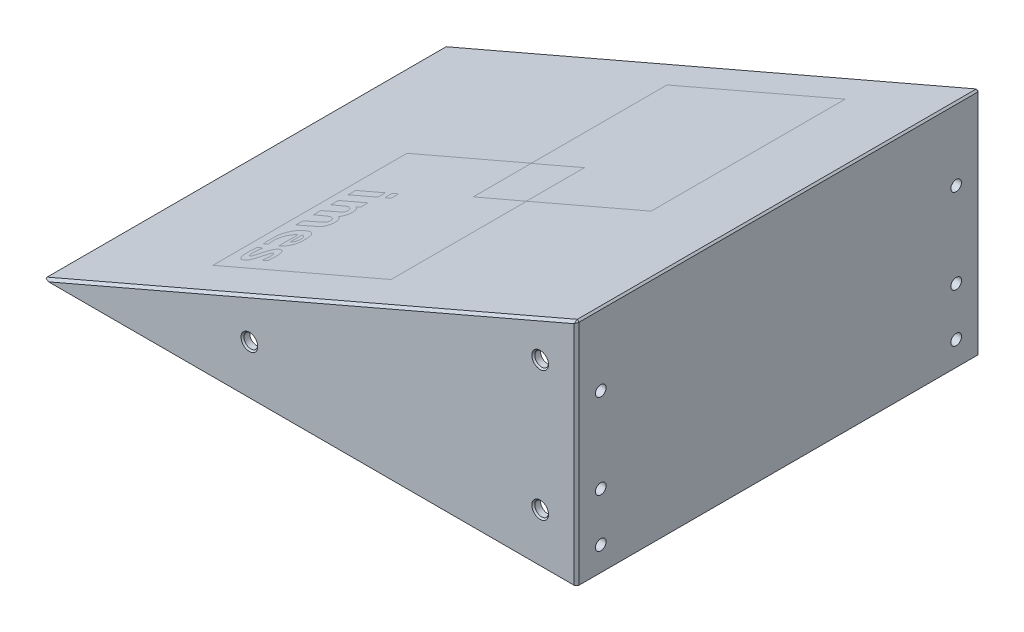
from build123d import *

# Parameters (mm, degrees)
BOSS_EXTRUDE1_DEPTH     = 166.666666667
CUT_EXTRUDE1_DEPTH      = 160.666666667
SKETCH3_R               = 2.2
CUT_EXTRUDE2_DEPTH      = 5
SKETCH4_R               = 2.2
CUT_EXTRUDE3_DEPTH      = 163.666666667
CUT_EXTRUDE7_DEPTH      = 1
BOSS_EXTRUDE5_DEPTH     = 1
BOSS_EXTRUDE5_2_DEPTH   = 1
BOSS_EXTRUDE6_DEPTH     = 1
SKETCH14_R              = 2.85
EINSCHMELZGEWINDE_DEPTH = 292.523236925
CHAMFER2_SIZE           = 0.6


with BuildPart() as part:
    # Sketch1 → Boss-Extrude1 (new body)
    with BuildSketch(Plane.XY):
        Polygon((0, 0), (-220.397368405, 0), (0, 95), align=None)
    extrude(amount=BOSS_EXTRUDE1_DEPTH)

    # Sketch2 → Cut-Extrude1 (cut)
    with BuildSketch(Plane.XY.offset(163.666666667)):
        Polygon((-5, 0), (-5, 87.400090745), (-178.22131418, 12.734839675), (-178.22131418, 0), align=None)
    extrude(amount=-CUT_EXTRUDE1_DEPTH, mode=Mode.SUBTRACT)

    # Sketch3 → Cut-Extrude2 (cut)
    with BuildSketch(Plane(origin=(0, 0, 0), x_dir=(0, 0, -1), z_dir=(1, 0, 0))):
        with Locations((-156.666666667, 10)):
            Circle(SKETCH3_R)
        with Locations((-156.666666667, 65)):
            Circle(SKETCH3_R)
        with Locations((-156.666666667, 30)):
            Circle(SKETCH3_R)
        with Locations((-10, 30)):
            Circle(SKETCH3_R)
        with Locations((-10, 65)):
            Circle(SKETCH3_R)
        with Locations((-10, 10)):
            Circle(SKETCH3_R)
    extrude(amount=-CUT_EXTRUDE2_DEPTH, mode=Mode.SUBTRACT)

    # Sketch4 → Cut-Extrude3 (cut)
    with BuildSketch(Plane(origin=(0, 0, 0), x_dir=(-1, 0, 0), z_dir=(0, 0, -1))):
        with Locations((15, 73.534405559)):
            Circle(SKETCH4_R)
        with Locations((15, 20)):
            Circle(SKETCH4_R)
        with Locations((135, 20)):
            Circle(SKETCH4_R)
    cut_extrude3 = extrude(amount=-CUT_EXTRUDE3_DEPTH, mode=Mode.SUBTRACT)

    # Mirror1: Cut-Extrude3 across plane
    add(cut_extrude3.mirror(Plane(origin=(0, 0, 83.333333333), x_dir=(1, 0, 0), z_dir=(0, 0, -1))), mode=Mode.SUBTRACT)

    # Chamfer1
    # the kernel refuses this chamfer: 1, 0.76094484 mm, written as the material it takes off along each edge
    with BuildSketch(Plane(origin=(-0.566264223, 94.059603605, 0.666666667), x_dir=(-0.6636676001479009, -0.3450951072209674, -0.6636676001479013), z_dir=(0.48166378315170105, 0.48166378315167974, -0.7321202087089269))) as chamfer1_piece_1:
        Polygon((-0.576464838, -0.320947287), (0.930313555, -0.320947287), (-0.353848716, 0.641894573), align=None)
    extrude(amount=1.335162391, mode=Mode.SUBTRACT)
    with BuildSketch(Plane(origin=(-0.566264223, 94.059603605, 166), x_dir=(-0.663667600147901, -0.3450951072209673, 0.6636676001479013), z_dir=(0.4816637831517013, 0.4816637831516795, 0.732120208708927))) as chamfer1_piece_2:
        Polygon((-0.576464838, 0.320947287), (0.930313555, 0.320947287), (-0.353848716, -0.641894573), align=None)
    extrude(amount=1.335162391, mode=Mode.SUBTRACT)
    with BuildSketch(Plane(origin=(-222.759002418, -1.017957849, 0), x_dir=(0.39568367544405514, -0.9179751661981379, -0.027495876610586115), z_dir=(0.9183223683555912, 0.39583333333333354, 0))) as chamfer1_piece_3:
        with BuildLine():
            Line((1.028673195, 0), (-0.056547155, -1.027117794))
            Line((-0.056547155, -1.027117794), (-0.076539593, -1.026567876))
            ThreePointArc((-0.076539593, -1.026567876), (-0.034129227, -0.51339783), (-0.019992438, 0.000549918))
            Line((-0.019992438, 0.000549918), (0.000549918, 0.019992438))
            ThreePointArc((0.000549918, 0.019992438), (0.514497665, 0.00585565), (1.029223113, 0.019992438))
            Line((1.029223113, 0.019992438), (1.028673195, 0))
        make_face()
    extrude(amount=245.143365976, mode=Mode.SUBTRACT)
    with BuildSketch(Plane(origin=(0, 97.571682988, 0), x_dir=(0.027495876610586372, 0, 0.9996219169112968), z_dir=(0, -1, 0))) as chamfer1_piece_4:
        with BuildLine():
            Line((1.028673195, 0), (-0.056547155, 1.027117794))
            Line((-0.056547155, 1.027117794), (-0.076539593, 1.026567876))
            ThreePointArc((-0.076539593, 1.026567876), (-0.034129227, 0.51339783), (-0.019992438, -0.000549918))
            Line((-0.019992438, -0.000549918), (0.000549918, -0.019992438))
            ThreePointArc((0.000549918, -0.019992438), (0.514497665, -0.00585565), (1.029223113, -0.019992438))
            Line((1.029223113, -0.019992438), (1.028673195, 0))
        make_face()
    extrude(amount=100.143365976, mode=Mode.SUBTRACT)
    with BuildSketch(Plane(origin=(0, 97.571682988, 166.666666667), x_dir=(0.027495876610586483, 0, -0.9996219169112968), z_dir=(0, -1, 0))) as chamfer1_piece_5:
        with BuildLine():
            Line((1.028673195, 0), (-0.056547155, -1.027117794))
            Line((-0.056547155, -1.027117794), (-0.076539593, -1.026567876))
            ThreePointArc((-0.076539593, -1.026567876), (-0.034129227, -0.51339783), (-0.019992438, 0.000549918))
            Line((-0.019992438, 0.000549918), (0.000549918, 0.019992438))
            ThreePointArc((0.000549918, 0.019992438), (0.514497665, 0.00585565), (1.029223113, 0.019992438))
            Line((1.029223113, 0.019992438), (1.028673195, 0))
        make_face()
    extrude(amount=100.143365976, mode=Mode.SUBTRACT)
    with BuildSketch(Plane(origin=(-222.759002418, -1.017957849, 166.666666667), x_dir=(0.3956836754440552, -0.9179751661981382, 0.027495876610582105), z_dir=(0.9183223683555912, 0.39583333333333354, 0))) as chamfer1_piece_6:
        with BuildLine():
            Line((1.028673195, 0), (-0.056547155, 1.027117794))
            Line((-0.056547155, 1.027117794), (-0.076539593, 1.026567876))
            ThreePointArc((-0.076539593, 1.026567876), (-0.034129227, 0.51339783), (-0.019992438, -0.000549918))
            Line((-0.019992438, -0.000549918), (0.000549918, -0.019992438))
            ThreePointArc((0.000549918, -0.019992438), (0.514497665, -0.00585565), (1.029223113, -0.019992438))
            Line((1.029223113, -0.019992438), (1.028673195, 0))
        make_face()
    extrude(amount=245.143365976, mode=Mode.SUBTRACT)
    with BuildSketch(Plane(origin=(-220.397368405, 0, -2.571682988), x_dir=(0.9987615609068209, -0.04975283363759973, 0), z_dir=(0, 0, 1))) as chamfer1_piece_7:
        with BuildLine():
            Line((0.747091846, 0), (0.910401862, 0.47889142))
            Line((0.910401862, 0.47889142), (0.901581217, 0.496841245))
            ThreePointArc((0.901581217, 0.496841245), (0.452617424, 0.244703092), (-0.008820645, 0.017949825))
            Line((-0.008820645, 0.017949825), (0.000995057, -0.019975231))
            ThreePointArc((0.000995057, -0.019975231), (0.373616325, -0.001413279), (0.748086903, -0.019975231))
            Line((0.748086903, -0.019975231), (0.747091846, 0))
        make_face()
    extrude(amount=171.810032643, mode=Mode.SUBTRACT)
    with BuildSketch(Plane(origin=(0, 95, -2.571682988), x_dir=(0.027495876610585647, -0.9996219169112968, 0), z_dir=(0, 0, 1))) as chamfer1_piece_8:
        with BuildLine():
            Line((1.028673195, 0), (0.252828256, -0.734306302))
            Line((0.252828256, -0.734306302), (0.234251077, -0.741714974))
            ThreePointArc((0.234251077, -0.741714974), (0.125099763, -0.367677326), (-0.018577179, -0.007408672))
            Line((-0.018577179, -0.007408672), (0.000549918, 0.019992438))
            ThreePointArc((0.000549918, 0.019992438), (0.514497665, 0.00585565), (1.029223113, 0.019992438))
            Line((1.029223113, 0.019992438), (1.028673195, 0))
        make_face()
    extrude(amount=171.810032643, mode=Mode.SUBTRACT)

    # Sketch13 → Cut-Extrude7 (cut)
    # profile 1 of 3: a face of its own
    with BuildSketch(Plane(origin=(-166.880136488, 23.068047813, 13.963503361), x_dir=(0, 0, 1), z_dir=(-0.3958333333333336, 0.9183223683555912, 0))):
        Polygon((55.9477248, 56.0831744), (55.9477248, 28.10930688), (55.9477248, 0.13544448), (95.97812736, 0.13544448), (136.0085248, 0.13544448), (136.0085248, 40.16584192), (136.0085248, 80.19624448), (108.03465728, 80.19624448), (80.061216138, 80.19624448), (80.06227456, 80.0607744), (80.02766336, 68.10584064), (79.99305728, 56.15092736), (68.03812352, 56.11631616), (56.083191808, 56.08170496), align=None)
        Polygon((84.93758976, 18.6943744), (84.93758976, 11.98877696), (84.93758976, 5.2831744), (83.37972736, 5.2831744), (81.82185984, 5.2831744), (81.82185984, 11.98877696), (81.82185984, 18.6943744), (83.37972736, 18.6943744), align=None, mode=Mode.SUBTRACT)
        with BuildLine():
            Line((96.11359232, 15.28617984), (95.79177984, 15.62858496))
            add(Edge.make_bspline(
                [(94.16347648, 15.90716416), (94.84733952, 16.18079232), (95.35429632, 16.09405952), (95.79177984, 15.62858496)],
                knots=[0, 0, 0, 0, 1, 1, 1, 1], degree=3))
            add(Edge.make_bspline(
                [(92.5133312, 13.74984192), (92.99899392, 14.9786624), (93.50885888, 15.64524032), (94.16347648, 15.90716416)],
                knots=[0, 0, 0, 0, 1, 1, 1, 1], degree=3))
            add(Edge.make_bspline(
                [(92.14528, 9.11010816), (92.1899264, 12.7598592), (92.20696576, 12.97467392), (92.5133312, 13.74984192)],
                knots=[0, 0, 0, 0, 1, 1, 1, 1], degree=3))
            Line((92.14528, 9.11010816), (92.098688, 5.2831744))
            Line((92.098688, 5.2831744), (90.55025152, 5.2831744))
            Line((90.55025152, 5.2831744), (89.00180992, 5.2831744))
            Line((89.00180992, 5.2831744), (89.00180992, 11.98877696))
            Line((89.00180992, 11.98877696), (89.00180992, 18.6943744))
            Line((89.00180992, 18.6943744), (90.55967744, 18.6943744))
            Line((90.55967744, 18.6943744), (92.11754496, 18.6943744))
            Line((92.11754496, 18.6943744), (92.11754496, 17.65185536))
            Line((92.11754496, 17.65185536), (92.11754496, 16.6093312))
            Line((92.11754496, 16.6093312), (92.509696, 17.22769408))
            add(Edge.make_bspline(
                [(96.97079808, 18.75655168), (95.15689472, 19.29522176), (93.44988672, 18.71021568), (92.509696, 17.22769408)],
                knots=[0, 0, 0, 0, 1, 1, 1, 1], degree=3))
            add(Edge.make_bspline(
                [(98.84232704, 16.9531392), (98.5273344, 17.84002048), (97.84586752, 18.49668608), (96.97079808, 18.75655168)],
                knots=[0, 0, 0, 0, 1, 1, 1, 1], degree=3))
            Line((98.84232704, 16.9531392), (99.07701248, 16.29236736))
            Line((99.07701248, 16.29236736), (99.57395456, 17.06122752))
            add(Edge.make_bspline(
                [(103.3669632, 18.92215296), (101.906048, 19.09517824), (100.41608704, 18.36417536), (99.57395456, 17.06122752)],
                knots=[0, 0, 0, 0, 1, 1, 1, 1], degree=3))
            add(Edge.make_bspline(
                [(106.09721344, 16.86557696), (105.53609728, 18.08348672), (104.61966848, 18.77379072), (103.3669632, 18.92215296)],
                knots=[0, 0, 0, 0, 1, 1, 1, 1], degree=3))
            add(Edge.make_bspline(
                [(106.44891648, 10.73570816), (106.40990208, 16.09991168), (106.40421888, 16.19921408), (106.09721344, 16.86557696)],
                knots=[0, 0, 0, 0, 1, 1, 1, 1], degree=3))
            Line((106.44891648, 10.73570816), (106.48854528, 5.2831744))
            Line((106.48854528, 5.2831744), (105.0018304, 5.2831744))
            Line((105.0018304, 5.2831744), (103.5151104, 5.2831744))
            Line((103.5151104, 5.2831744), (103.4720512, 10.12611072))
            add(Edge.make_bspline(
                [(102.56379904, 15.97869056), (103.39983872, 15.63238912), (103.424512, 15.47338752), (103.4720512, 10.12611072)],
                knots=[0, 0, 0, 0, 1, 1, 1, 1], degree=3))
            add(Edge.make_bspline(
                [(99.98057984, 14.34333184), (100.52537856, 15.60974336), (101.68388608, 16.34316288), (102.56379904, 15.97869056)],
                knots=[0, 0, 0, 0, 1, 1, 1, 1], degree=3))
            add(Edge.make_bspline(
                [(99.29961472, 8.5682432), (99.30217472, 12.05631488), (99.41742592, 13.03423488), (99.98057984, 14.34333184)],
                knots=[0, 0, 0, 0, 1, 1, 1, 1], degree=3))
            Line((99.29961472, 8.5682432), (99.29705472, 5.2831744))
            Line((99.29705472, 5.2831744), (97.74395392, 5.2831744))
            Line((97.74395392, 5.2831744), (96.19085312, 5.2831744))
            Line((96.19085312, 5.2831744), (96.15224832, 10.28467712))
            Line((96.15224832, 10.28467712), (96.11359232, 15.28617984))
        make_face(mode=Mode.SUBTRACT)
        Polygon((84.93758976, 24.65490944), (84.93758976, 23.1647744), (84.93758976, 21.67464448), (83.37972736, 21.67464448), (81.82185984, 21.67464448), (81.82185984, 23.1647744), (81.82185984, 24.65490944), (83.37972736, 24.65490944), align=None, mode=Mode.SUBTRACT)
        with BuildLine():
            Line((120.02345984, 5.44058368), (119.3799936, 5.28499712))
            Line((119.3799936, 5.28499712), (119.37975808, 5.28499712))
            add(Edge.make_bspline(
                [(114.21233152, 5.2183552), (115.05984, 4.98085888), (118.29446144, 5.02257152), (119.37975808, 5.28499712)],
                knots=[0, 0, 0, 0, 1, 1, 1, 1], degree=3))
            add(Edge.make_bspline(
                [(109.9058944, 9.88904448), (110.56429056, 7.42414336), (112.03566592, 5.82831616), (114.21233152, 5.2183552)],
                knots=[0, 0, 0, 0, 1, 1, 1, 1], degree=3))
            add(Edge.make_bspline(
                [(109.96598784, 15.40030464), (109.56829184, 14.13541376), (109.53704448, 11.26994432), (109.9058944, 9.88904448)],
                knots=[0, 0, 0, 0, 1, 1, 1, 1], degree=3))
            add(Edge.make_bspline(
                [(111.73879808, 17.97809664), (110.880128, 17.32316672), (110.30983168, 16.49392128), (109.96598784, 15.40030464)],
                knots=[0, 0, 0, 0, 1, 1, 1, 1], degree=3))
            add(Edge.make_bspline(
                [(115.34962176, 18.89321984), (113.6010496, 18.89833984), (112.61898752, 18.64944128), (111.73879808, 17.97809664)],
                knots=[0, 0, 0, 0, 1, 1, 1, 1], degree=3))
            add(Edge.make_bspline(
                [(117.6525568, 18.51360256), (116.9232128, 18.8503296), (116.68675584, 18.88930816), (115.34962176, 18.89321984)],
                knots=[0, 0, 0, 0, 1, 1, 1, 1], degree=3))
            add(Edge.make_bspline(
                [(118.96238592, 17.65451264), (118.68901888, 17.92062464), (118.09959424, 18.30721536), (117.6525568, 18.51360256)],
                knots=[0, 0, 0, 0, 1, 1, 1, 1], degree=3))
            add(Edge.make_bspline(
                [(120.42883584, 13.4450432), (120.42678784, 15.07685376), (119.81919744, 16.82044928), (118.96238592, 17.65451264)],
                knots=[0, 0, 0, 0, 1, 1, 1, 1], degree=3))
            Line((120.42883584, 13.4450432), (120.42985984, 12.86930944))
            Line((120.42985984, 12.86930944), (116.4970752, 12.86930944))
            add(Edge.make_bspline(
                [(112.55718912, 11.67983104), (112.30148096, 12.95308288), (112.02400768, 12.86930944), (116.4970752, 12.86930944)],
                knots=[0, 0, 0, 0, 1, 1, 1, 1], degree=3))
            add(Edge.make_bspline(
                [(115.30171392, 7.65583872), (113.98072832, 8.37557248), (112.90361856, 9.954816), (112.55718912, 11.67983104)],
                knots=[0, 0, 0, 0, 1, 1, 1, 1], degree=3))
            add(Edge.make_bspline(
                [(117.21089536, 7.20364544), (116.22436864, 7.25110784), (115.90634496, 7.32640256), (115.30171392, 7.65583872)],
                knots=[0, 0, 0, 0, 1, 1, 1, 1], degree=3))
            add(Edge.make_bspline(
                [(119.80281856, 7.53042944), (119.09603328, 7.25920768), (118.25651712, 7.15336192), (117.21089536, 7.20364544)],
                knots=[0, 0, 0, 0, 1, 1, 1, 1], degree=3))
            add(Edge.make_bspline(
                [(120.02345984, 6.52784128), (120.02345984, 7.47683328), (119.99540224, 7.60433152), (119.80281856, 7.53042944)],
                knots=[0, 0, 0, 0, 1, 1, 1, 1], degree=3))
            Line((120.02345984, 6.52784128), (120.02345984, 5.44058368))
        make_face(mode=Mode.SUBTRACT)
        with BuildLine():
            Line((130.3189248, 18.53386752), (130.3189248, 17.25945344))
            add(Edge.make_bspline(
                [(130.26732032, 15.98504448), (130.29568512, 15.98504448), (130.3189248, 16.55852544), (130.3189248, 17.25945344)],
                knots=[0, 0, 0, 0, 1, 1, 1, 1], degree=3))
            add(Edge.make_bspline(
                [(129.35291904, 16.30784), (129.827456, 16.130304), (130.23893504, 15.98504448), (130.26732032, 15.98504448)],
                knots=[0, 0, 0, 0, 1, 1, 1, 1], degree=3))
            add(Edge.make_bspline(
                [(127.91046656, 16.72681472), (128.22927872, 16.67392), (128.87838208, 16.48538112), (129.35291904, 16.30784)],
                knots=[0, 0, 0, 0, 1, 1, 1, 1], degree=3))
            add(Edge.make_bspline(
                [(125.30665984, 15.53564672), (125.30665984, 16.27826176), (126.71919616, 16.92445696), (127.91046656, 16.72681472)],
                knots=[0, 0, 0, 0, 1, 1, 1, 1], degree=3))
            add(Edge.make_bspline(
                [(127.80204032, 13.2158976), (125.81556736, 14.51283968), (125.30665984, 14.98592768), (125.30665984, 15.53564672)],
                knots=[0, 0, 0, 0, 1, 1, 1, 1], degree=3))
            add(Edge.make_bspline(
                [(131.127424, 8.87304192), (131.124352, 10.65903104), (130.53051904, 11.43450624), (127.80204032, 13.2158976)],
                knots=[0, 0, 0, 0, 1, 1, 1, 1], degree=3))
            add(Edge.make_bspline(
                [(128.08372736, 5.1959296), (130.11843072, 5.7381376), (131.13075712, 6.96113152), (131.127424, 8.87304192)],
                knots=[0, 0, 0, 0, 1, 1, 1, 1], degree=3))
            add(Edge.make_bspline(
                [(123.74879232, 5.2180992), (124.8105216, 4.97885696), (127.22277888, 4.96653312), (128.08372736, 5.1959296)],
                knots=[0, 0, 0, 0, 1, 1, 1, 1], degree=3))
            add(Edge.make_bspline(
                [(122.76665856, 5.4099456), (122.85979136, 5.4053376), (123.30174976, 5.31883008), (123.74879232, 5.2180992)],
                knots=[0, 0, 0, 0, 1, 1, 1, 1], degree=3))
            add(Edge.make_bspline(
                [(122.5973248, 6.78780416), (122.5973248, 5.78742272), (122.642944, 5.41629952), (122.76665856, 5.4099456)],
                knots=[0, 0, 0, 0, 1, 1, 1, 1], degree=3))
            add(Edge.make_bspline(
                [(122.83439104, 8.05780992), (122.61771264, 8.14843392), (122.5973248, 8.03922432), (122.5973248, 6.78780416)],
                knots=[0, 0, 0, 0, 1, 1, 1, 1], degree=3))
            add(Edge.make_bspline(
                [(128.2869248, 8.54756864), (128.2869248, 7.20859136), (125.46983936, 6.95555584), (122.83439104, 8.05780992)],
                knots=[0, 0, 0, 0, 1, 1, 1, 1], degree=3))
            add(Edge.make_bspline(
                [(125.85259008, 10.84009472), (127.7722624, 9.53900544), (128.2869248, 9.05432576), (128.2869248, 8.54756864)],
                knots=[0, 0, 0, 0, 1, 1, 1, 1], degree=3))
            add(Edge.make_bspline(
                [(122.6016256, 15.17224448), (122.6046976, 13.51450112), (123.32726272, 12.55168512), (125.85259008, 10.84009472)],
                knots=[0, 0, 0, 0, 1, 1, 1, 1], degree=3))
            add(Edge.make_bspline(
                [(129.01808128, 18.76808704), (125.2164864, 19.45257984), (122.59634688, 17.9842304), (122.6016256, 15.17224448)],
                knots=[0, 0, 0, 0, 1, 1, 1, 1], degree=3))
            Line((129.01808128, 18.76808704), (130.3189248, 18.53386752))
        make_face(mode=Mode.SUBTRACT)
    # profile 2 of 3: a face of its own
    with BuildSketch(Plane(origin=(-166.880136488, 23.068047813, 13.963503361), x_dir=(0, 0, 1), z_dir=(-0.3958333333333336, 0.9183223683555912, 0))):
        Polygon((27.973858304, 56.0831744), (55.9477248, 56.0831744), (56.083191808, 56.08170496), (56.083191808, 68.07123968), (56.083191808, 80.0607744), (68.0727296, 80.0607744), (80.06227456, 80.0607744), (80.061216138, 80.19624448), (80.06078976, 80.19624448), (80.06078976, 80.250817587), (80.06078976, 108.170108928), (80.06078976, 136.143975936), (40.030391808, 136.143975936), (-8.192e-06, 136.143975936), (-8.192e-06, 96.113575936), (-8.192e-06, 56.0831744), align=None)
    # profile 3 of 3: a face of its own
    with BuildSketch(Plane(origin=(-166.880136488, 23.068047813, 13.963503361), x_dir=(0, 0, 1), z_dir=(-0.3958333333333336, 0.9183223683555912, 0))):
        with BuildLine():
            Line((117.48526592, 14.6303744), (117.41343744, 15.1659008))
            add(Edge.make_bspline(
                [(113.43136768, 16.35399168), (114.89675776, 17.64062208), (117.1725824, 16.96160256), (117.41343744, 15.1659008)],
                knots=[0, 0, 0, 0, 1, 1, 1, 1], degree=3))
            add(Edge.make_bspline(
                [(112.57278976, 14.83792896), (112.57278976, 15.26205952), (112.95362048, 15.93452544), (113.43136768, 16.35399168)],
                knots=[0, 0, 0, 0, 1, 1, 1, 1], degree=3))
            add(Edge.make_bspline(
                [(115.02902784, 14.6303744), (112.91313152, 14.6303744), (112.57278976, 14.6591488), (112.57278976, 14.83792896)],
                knots=[0, 0, 0, 0, 1, 1, 1, 1], degree=3))
            Line((115.02902784, 14.6303744), (117.48526592, 14.6303744))
        make_face()
    extrude(amount=-CUT_EXTRUDE7_DEPTH, mode=Mode.SUBTRACT)

    # Sketch14 → Einschmelzgewinde (cut, through all)
    with BuildSketch(Plane.XY.offset(166.666666667)):
        with Locations((-135, 20)):
            Circle(SKETCH14_R)
        with Locations((-15, 20)):
            Circle(SKETCH14_R)
        with Locations((-15, 73.534405559)):
            Circle(SKETCH14_R)
    extrude(amount=-EINSCHMELZGEWINDE_DEPTH, mode=Mode.SUBTRACT)

    # Chamfer2
    chamfer2_edges = [part.edges().sort_by_distance(p)[0] for p in [
        (-137.85, 20, 0),
        (-137.85, 20, 166.666666667),
        (-17.85, 20, 0),
        (-17.85, 20, 166.666666667),
        (-17.85, 73.534405559, 0),
        (-17.85, 73.534405559, 166.666666667),
    ]]
    chamfer(chamfer2_edges, length=CHAMFER2_SIZE)


with BuildPart() as body_2:
    # Sketch13<3> → Boss-Extrude5 (new body)
    with BuildSketch(Plane(origin=(-166.880136488, 23.068047813, 13.963503361), x_dir=(0, 0, 1), z_dir=(-0.3958333333333336, 0.9183223683555912, 0))):
        Polygon((55.9477248, 56.0831744), (55.9477248, 28.10930688), (55.9477248, 0.13544448), (95.97812736, 0.13544448), (136.0085248, 0.13544448), (136.0085248, 40.16584192), (136.0085248, 80.19624448), (108.03465728, 80.19624448), (80.061216138, 80.19624448), (80.06227456, 80.0607744), (80.02766336, 68.10584064), (79.99305728, 56.15092736), (68.03812352, 56.11631616), (56.083191808, 56.08170496), align=None)
        Polygon((84.93758976, 18.6943744), (84.93758976, 11.98877696), (84.93758976, 5.2831744), (83.37972736, 5.2831744), (81.82185984, 5.2831744), (81.82185984, 11.98877696), (81.82185984, 18.6943744), (83.37972736, 18.6943744), align=None, mode=Mode.SUBTRACT)
        with BuildLine():
            Line((96.11359232, 15.28617984), (95.79177984, 15.62858496))
            add(Edge.make_bspline(
                [(94.16347648, 15.90716416), (94.84733952, 16.18079232), (95.35429632, 16.09405952), (95.79177984, 15.62858496)],
                knots=[0, 0, 0, 0, 1, 1, 1, 1], degree=3))
            add(Edge.make_bspline(
                [(92.5133312, 13.74984192), (92.99899392, 14.9786624), (93.50885888, 15.64524032), (94.16347648, 15.90716416)],
                knots=[0, 0, 0, 0, 1, 1, 1, 1], degree=3))
            add(Edge.make_bspline(
                [(92.14528, 9.11010816), (92.1899264, 12.7598592), (92.20696576, 12.97467392), (92.5133312, 13.74984192)],
                knots=[0, 0, 0, 0, 1, 1, 1, 1], degree=3))
            Line((92.14528, 9.11010816), (92.098688, 5.2831744))
            Line((92.098688, 5.2831744), (90.55025152, 5.2831744))
            Line((90.55025152, 5.2831744), (89.00180992, 5.2831744))
            Line((89.00180992, 5.2831744), (89.00180992, 11.98877696))
            Line((89.00180992, 11.98877696), (89.00180992, 18.6943744))
            Line((89.00180992, 18.6943744), (90.55967744, 18.6943744))
            Line((90.55967744, 18.6943744), (92.11754496, 18.6943744))
            Line((92.11754496, 18.6943744), (92.11754496, 17.65185536))
            Line((92.11754496, 17.65185536), (92.11754496, 16.6093312))
            Line((92.11754496, 16.6093312), (92.509696, 17.22769408))
            add(Edge.make_bspline(
                [(96.97079808, 18.75655168), (95.15689472, 19.29522176), (93.44988672, 18.71021568), (92.509696, 17.22769408)],
                knots=[0, 0, 0, 0, 1, 1, 1, 1], degree=3))
            add(Edge.make_bspline(
                [(98.84232704, 16.9531392), (98.5273344, 17.84002048), (97.84586752, 18.49668608), (96.97079808, 18.75655168)],
                knots=[0, 0, 0, 0, 1, 1, 1, 1], degree=3))
            Line((98.84232704, 16.9531392), (99.07701248, 16.29236736))
            Line((99.07701248, 16.29236736), (99.57395456, 17.06122752))
            add(Edge.make_bspline(
                [(103.3669632, 18.92215296), (101.906048, 19.09517824), (100.41608704, 18.36417536), (99.57395456, 17.06122752)],
                knots=[0, 0, 0, 0, 1, 1, 1, 1], degree=3))
            add(Edge.make_bspline(
                [(106.09721344, 16.86557696), (105.53609728, 18.08348672), (104.61966848, 18.77379072), (103.3669632, 18.92215296)],
                knots=[0, 0, 0, 0, 1, 1, 1, 1], degree=3))
            add(Edge.make_bspline(
                [(106.44891648, 10.73570816), (106.40990208, 16.09991168), (106.40421888, 16.19921408), (106.09721344, 16.86557696)],
                knots=[0, 0, 0, 0, 1, 1, 1, 1], degree=3))
            Line((106.44891648, 10.73570816), (106.48854528, 5.2831744))
            Line((106.48854528, 5.2831744), (105.0018304, 5.2831744))
            Line((105.0018304, 5.2831744), (103.5151104, 5.2831744))
            Line((103.5151104, 5.2831744), (103.4720512, 10.12611072))
            add(Edge.make_bspline(
                [(102.56379904, 15.97869056), (103.39983872, 15.63238912), (103.424512, 15.47338752), (103.4720512, 10.12611072)],
                knots=[0, 0, 0, 0, 1, 1, 1, 1], degree=3))
            add(Edge.make_bspline(
                [(99.98057984, 14.34333184), (100.52537856, 15.60974336), (101.68388608, 16.34316288), (102.56379904, 15.97869056)],
                knots=[0, 0, 0, 0, 1, 1, 1, 1], degree=3))
            add(Edge.make_bspline(
                [(99.29961472, 8.5682432), (99.30217472, 12.05631488), (99.41742592, 13.03423488), (99.98057984, 14.34333184)],
                knots=[0, 0, 0, 0, 1, 1, 1, 1], degree=3))
            Line((99.29961472, 8.5682432), (99.29705472, 5.2831744))
            Line((99.29705472, 5.2831744), (97.74395392, 5.2831744))
            Line((97.74395392, 5.2831744), (96.19085312, 5.2831744))
            Line((96.19085312, 5.2831744), (96.15224832, 10.28467712))
            Line((96.15224832, 10.28467712), (96.11359232, 15.28617984))
        make_face(mode=Mode.SUBTRACT)
        Polygon((84.93758976, 24.65490944), (84.93758976, 23.1647744), (84.93758976, 21.67464448), (83.37972736, 21.67464448), (81.82185984, 21.67464448), (81.82185984, 23.1647744), (81.82185984, 24.65490944), (83.37972736, 24.65490944), align=None, mode=Mode.SUBTRACT)
        with BuildLine():
            Line((120.02345984, 5.44058368), (119.3799936, 5.28499712))
            Line((119.3799936, 5.28499712), (119.37975808, 5.28499712))
            add(Edge.make_bspline(
                [(114.21233152, 5.2183552), (115.05984, 4.98085888), (118.29446144, 5.02257152), (119.37975808, 5.28499712)],
                knots=[0, 0, 0, 0, 1, 1, 1, 1], degree=3))
            add(Edge.make_bspline(
                [(109.9058944, 9.88904448), (110.56429056, 7.42414336), (112.03566592, 5.82831616), (114.21233152, 5.2183552)],
                knots=[0, 0, 0, 0, 1, 1, 1, 1], degree=3))
            add(Edge.make_bspline(
                [(109.96598784, 15.40030464), (109.56829184, 14.13541376), (109.53704448, 11.26994432), (109.9058944, 9.88904448)],
                knots=[0, 0, 0, 0, 1, 1, 1, 1], degree=3))
            add(Edge.make_bspline(
                [(111.73879808, 17.97809664), (110.880128, 17.32316672), (110.30983168, 16.49392128), (109.96598784, 15.40030464)],
                knots=[0, 0, 0, 0, 1, 1, 1, 1], degree=3))
            add(Edge.make_bspline(
                [(115.34962176, 18.89321984), (113.6010496, 18.89833984), (112.61898752, 18.64944128), (111.73879808, 17.97809664)],
                knots=[0, 0, 0, 0, 1, 1, 1, 1], degree=3))
            add(Edge.make_bspline(
                [(117.6525568, 18.51360256), (116.9232128, 18.8503296), (116.68675584, 18.88930816), (115.34962176, 18.89321984)],
                knots=[0, 0, 0, 0, 1, 1, 1, 1], degree=3))
            add(Edge.make_bspline(
                [(118.96238592, 17.65451264), (118.68901888, 17.92062464), (118.09959424, 18.30721536), (117.6525568, 18.51360256)],
                knots=[0, 0, 0, 0, 1, 1, 1, 1], degree=3))
            add(Edge.make_bspline(
                [(120.42883584, 13.4450432), (120.42678784, 15.07685376), (119.81919744, 16.82044928), (118.96238592, 17.65451264)],
                knots=[0, 0, 0, 0, 1, 1, 1, 1], degree=3))
            Line((120.42883584, 13.4450432), (120.42985984, 12.86930944))
            Line((120.42985984, 12.86930944), (116.4970752, 12.86930944))
            add(Edge.make_bspline(
                [(112.55718912, 11.67983104), (112.30148096, 12.95308288), (112.02400768, 12.86930944), (116.4970752, 12.86930944)],
                knots=[0, 0, 0, 0, 1, 1, 1, 1], degree=3))
            add(Edge.make_bspline(
                [(115.30171392, 7.65583872), (113.98072832, 8.37557248), (112.90361856, 9.954816), (112.55718912, 11.67983104)],
                knots=[0, 0, 0, 0, 1, 1, 1, 1], degree=3))
            add(Edge.make_bspline(
                [(117.21089536, 7.20364544), (116.22436864, 7.25110784), (115.90634496, 7.32640256), (115.30171392, 7.65583872)],
                knots=[0, 0, 0, 0, 1, 1, 1, 1], degree=3))
            add(Edge.make_bspline(
                [(119.80281856, 7.53042944), (119.09603328, 7.25920768), (118.25651712, 7.15336192), (117.21089536, 7.20364544)],
                knots=[0, 0, 0, 0, 1, 1, 1, 1], degree=3))
            add(Edge.make_bspline(
                [(120.02345984, 6.52784128), (120.02345984, 7.47683328), (119.99540224, 7.60433152), (119.80281856, 7.53042944)],
                knots=[0, 0, 0, 0, 1, 1, 1, 1], degree=3))
            Line((120.02345984, 6.52784128), (120.02345984, 5.44058368))
        make_face(mode=Mode.SUBTRACT)
        with BuildLine():
            Line((130.3189248, 18.53386752), (130.3189248, 17.25945344))
            add(Edge.make_bspline(
                [(130.26732032, 15.98504448), (130.29568512, 15.98504448), (130.3189248, 16.55852544), (130.3189248, 17.25945344)],
                knots=[0, 0, 0, 0, 1, 1, 1, 1], degree=3))
            add(Edge.make_bspline(
                [(129.35291904, 16.30784), (129.827456, 16.130304), (130.23893504, 15.98504448), (130.26732032, 15.98504448)],
                knots=[0, 0, 0, 0, 1, 1, 1, 1], degree=3))
            add(Edge.make_bspline(
                [(127.91046656, 16.72681472), (128.22927872, 16.67392), (128.87838208, 16.48538112), (129.35291904, 16.30784)],
                knots=[0, 0, 0, 0, 1, 1, 1, 1], degree=3))
            add(Edge.make_bspline(
                [(125.30665984, 15.53564672), (125.30665984, 16.27826176), (126.71919616, 16.92445696), (127.91046656, 16.72681472)],
                knots=[0, 0, 0, 0, 1, 1, 1, 1], degree=3))
            add(Edge.make_bspline(
                [(127.80204032, 13.2158976), (125.81556736, 14.51283968), (125.30665984, 14.98592768), (125.30665984, 15.53564672)],
                knots=[0, 0, 0, 0, 1, 1, 1, 1], degree=3))
            add(Edge.make_bspline(
                [(131.127424, 8.87304192), (131.124352, 10.65903104), (130.53051904, 11.43450624), (127.80204032, 13.2158976)],
                knots=[0, 0, 0, 0, 1, 1, 1, 1], degree=3))
            add(Edge.make_bspline(
                [(128.08372736, 5.1959296), (130.11843072, 5.7381376), (131.13075712, 6.96113152), (131.127424, 8.87304192)],
                knots=[0, 0, 0, 0, 1, 1, 1, 1], degree=3))
            add(Edge.make_bspline(
                [(123.74879232, 5.2180992), (124.8105216, 4.97885696), (127.22277888, 4.96653312), (128.08372736, 5.1959296)],
                knots=[0, 0, 0, 0, 1, 1, 1, 1], degree=3))
            add(Edge.make_bspline(
                [(122.76665856, 5.4099456), (122.85979136, 5.4053376), (123.30174976, 5.31883008), (123.74879232, 5.2180992)],
                knots=[0, 0, 0, 0, 1, 1, 1, 1], degree=3))
            add(Edge.make_bspline(
                [(122.5973248, 6.78780416), (122.5973248, 5.78742272), (122.642944, 5.41629952), (122.76665856, 5.4099456)],
                knots=[0, 0, 0, 0, 1, 1, 1, 1], degree=3))
            add(Edge.make_bspline(
                [(122.83439104, 8.05780992), (122.61771264, 8.14843392), (122.5973248, 8.03922432), (122.5973248, 6.78780416)],
                knots=[0, 0, 0, 0, 1, 1, 1, 1], degree=3))
            add(Edge.make_bspline(
                [(128.2869248, 8.54756864), (128.2869248, 7.20859136), (125.46983936, 6.95555584), (122.83439104, 8.05780992)],
                knots=[0, 0, 0, 0, 1, 1, 1, 1], degree=3))
            add(Edge.make_bspline(
                [(125.85259008, 10.84009472), (127.7722624, 9.53900544), (128.2869248, 9.05432576), (128.2869248, 8.54756864)],
                knots=[0, 0, 0, 0, 1, 1, 1, 1], degree=3))
            add(Edge.make_bspline(
                [(122.6016256, 15.17224448), (122.6046976, 13.51450112), (123.32726272, 12.55168512), (125.85259008, 10.84009472)],
                knots=[0, 0, 0, 0, 1, 1, 1, 1], degree=3))
            add(Edge.make_bspline(
                [(129.01808128, 18.76808704), (125.2164864, 19.45257984), (122.59634688, 17.9842304), (122.6016256, 15.17224448)],
                knots=[0, 0, 0, 0, 1, 1, 1, 1], degree=3))
            Line((129.01808128, 18.76808704), (130.3189248, 18.53386752))
        make_face(mode=Mode.SUBTRACT)
    extrude(amount=-BOSS_EXTRUDE5_DEPTH)


with BuildPart() as body_3:
    # Sketch13<3> → Boss-Extrude5 2 (new body)
    with BuildSketch(Plane(origin=(-166.880136488, 23.068047813, 13.963503361), x_dir=(0, 0, 1), z_dir=(-0.3958333333333336, 0.9183223683555912, 0))):
        with BuildLine():
            Line((117.48526592, 14.6303744), (117.41343744, 15.1659008))
            add(Edge.make_bspline(
                [(113.43136768, 16.35399168), (114.89675776, 17.64062208), (117.1725824, 16.96160256), (117.41343744, 15.1659008)],
                knots=[0, 0, 0, 0, 1, 1, 1, 1], degree=3))
            add(Edge.make_bspline(
                [(112.57278976, 14.83792896), (112.57278976, 15.26205952), (112.95362048, 15.93452544), (113.43136768, 16.35399168)],
                knots=[0, 0, 0, 0, 1, 1, 1, 1], degree=3))
            add(Edge.make_bspline(
                [(115.02902784, 14.6303744), (112.91313152, 14.6303744), (112.57278976, 14.6591488), (112.57278976, 14.83792896)],
                knots=[0, 0, 0, 0, 1, 1, 1, 1], degree=3))
            Line((115.02902784, 14.6303744), (117.48526592, 14.6303744))
        make_face()
    extrude(amount=-BOSS_EXTRUDE5_2_DEPTH)


with BuildPart() as body_4:
    # Sketch13<4> → Boss-Extrude6 (new body)
    with BuildSketch(Plane(origin=(-166.880136488, 23.068047813, 13.963503361), x_dir=(0, 0, 1), z_dir=(-0.3958333333333336, 0.9183223683555912, 0))):
        Polygon((27.973858304, 56.0831744), (55.9477248, 56.0831744), (56.083191808, 56.08170496), (56.083191808, 68.07123968), (56.083191808, 80.0607744), (68.0727296, 80.0607744), (80.06227456, 80.0607744), (80.061216138, 80.19624448), (80.06078976, 80.19624448), (80.06078976, 80.250817587), (80.06078976, 108.170108928), (80.06078976, 136.143975936), (40.030391808, 136.143975936), (-8.192e-06, 136.143975936), (-8.192e-06, 96.113575936), (-8.192e-06, 56.0831744), align=None)
    extrude(amount=-BOSS_EXTRUDE6_DEPTH)


solid = Compound([part.part, body_2.part, body_3.part, body_4.part])
